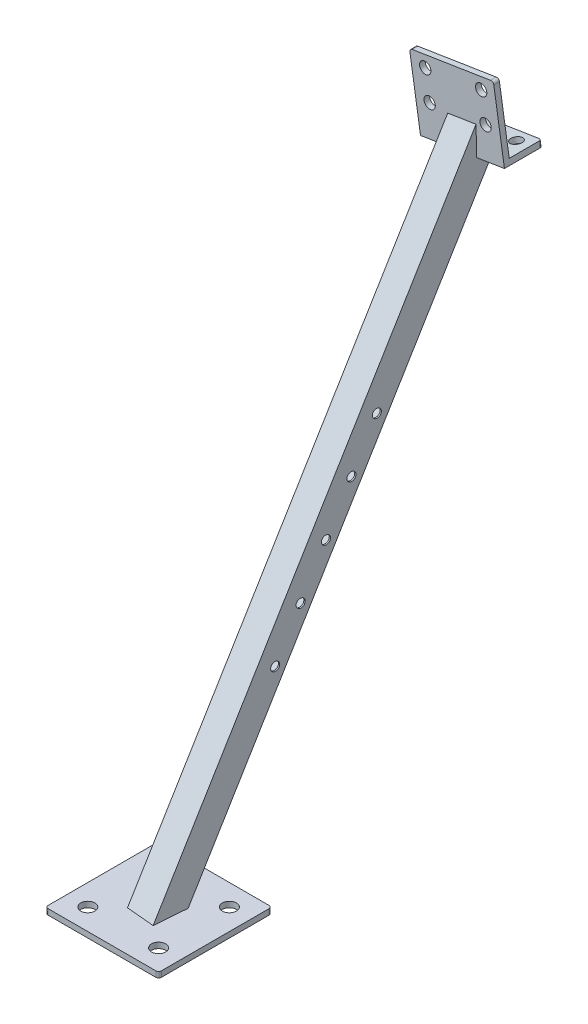
from build123d import *

# Parameters (mm, degrees)
BOSS_EXTRUDE1_DEPTH      = 60
BOSS_EXTRUDE2_DEPTH      = 500
BOSS_EXTRUDE2_DEPTH_BACK = 20
CUT_EXTRUDE1_DEPTH       = 60
BOSS_EXTRUDE3_DEPTH      = 4
SKETCH7_W                = 66.53307322741853
SKETCH7_H                = 100.00000000000006
CUT_EXTRUDE2_DEPTH       = 100
CUT_EXTRUDE3_REACH       = 450.752
SKETCH8_R                = 3.999999996290614
SKETCH8_R_2              = 3.999999996290612
SKETCH8_R_3              = 3.999999996290599
SKETCH8_R_4              = 3.9999999962905974
CUT_EXTRUDE4_REACH       = 450.752
SKETCH9_R                = 4.000000002943936
SKETCH9_R_2              = 4.000000002943917
CUT_EXTRUDE5_REACH       = 492.61
SKETCH10_R               = 5.000000000000006
SKETCH10_R_2             = 5.000000000000005
FILLET1_R                = 2
FILLET2_R                = 2
SKETCH11_RX              = 3.0000000000000298
SKETCH11_RY              = 2.9901642246261853
SKETCH11_RY_2            = 2.990164224626172
SKETCH11_RX_2            = 3.000000000000057
SKETCH11_RX_3            = 3.0000000000000533
SKETCH11_RX_4            = 3.0000000000000058
SKETCH11_RY_3            = 2.9901642246261186
CUT_EXTRUDE6_DEPTH       = 450.440489599581
BODY_MOVE_COPY1_ANGLE    = 9.0000001


with BuildPart() as part:
    # Sketch1 → Boss-Extrude1 (new body)
    with BuildSketch(Plane(origin=(0, 0, 0), x_dir=(0, 0, -1), z_dir=(1, 0, 0))):
        Polygon((0, 0), (0, 50), (4, 50), (4.000000000000005, 4), (27, 4), (27, -2.82e-15), align=None)
    extrude(amount=BOSS_EXTRUDE1_DEPTH)

    # Sketch3 → Boss-Extrude2 (add, two sides: drawn at the far end of the back side and taken through both)
    with BuildSketch(Plane(origin=(0.7341522555726998, 4.014248509947268, -2.3176274578121165), x_dir=(0, -0.5000000000000011, -0.8660254037844382), z_dir=(-0.15643446504023129, -0.8553631939770857, 0.49384417029756994)).offset(-BOSS_EXTRUDE2_DEPTH_BACK)):
        Polygon((-10, 39.63065021785413), (10, 39.63065021785413), (10.000000000000002, 19.630650217854132), (-9.999999999999998, 19.630650217854132), align=None)
        Polygon((-9.000000000000002, 38.63065021785413), (9.000000000000002, 38.63065021785413), (9.000000000000005, 20.630650217854136), (-9, 20.630650217854136), align=None, mode=Mode.SUBTRACT)
    extrude(amount=BOSS_EXTRUDE2_DEPTH + BOSS_EXTRUDE2_DEPTH_BACK)

    # Sketch4 → Cut-Extrude1 (cut)
    with BuildSketch(Plane.ZY):
        Polygon((-4.000000000000005, 3.9999999999999947), (-4.000000000000005, 34.425897354185985), (-31.38403913433122, 4), align=None)
    extrude(amount=-CUT_EXTRUDE1_DEPTH, mode=Mode.SUBTRACT)

    # Sketch6 → Boss-Extrude3 (add)
    with BuildSketch(Plane(origin=(-56.75697758695906, -358.3494490271577, -6.0350178588e-07), x_dir=(0.9876883403131397, -0.15643446682069626, -2.634536772853159e-10), z_dir=(0.15643446682069626, 0.9876883403131398, 1.663381034600109e-09))):
        Polygon((60.60249934727371, -165.5937403388422), (-19.397500652726297, -165.5937403388422), (-19.397500652726286, -245.5937403388422), (60.602499347273714, -245.5937403388422), align=None)
    extrude(amount=BOSS_EXTRUDE3_DEPTH)

    # Sketch7 → Cut-Extrude2 (cut)
    with BuildSketch(Plane(origin=(-56.75697758695889, -358.34944902715785, -6.0350179691e-07), x_dir=(0.9876883403131398, -0.15643446682069573, -2.6345368210226206e-10), z_dir=(-0.15643446682069573, -0.9876883403131398, -1.6633810650131218e-09))):
        with Locations((19.033988730271286, 218.77379525877697)):
            Rectangle(SKETCH7_W, SKETCH7_H)
    extrude(amount=CUT_EXTRUDE2_DEPTH, mode=Mode.SUBTRACT)

    # Sketch8 → Cut-Extrude3 (cut, up to next)
    with BuildSketch(Plane.XY, mode=Mode.PRIVATE) as cut_extrude3_sk1:
        with Locations((10.000000000000002, 21.999999999999982)):
            Circle(SKETCH8_R)
    cut_extrude3_tool1 = extrude(cut_extrude3_sk1.sketch, amount=-CUT_EXTRUDE3_REACH, mode=Mode.PRIVATE) & part.part
    # Sketch8 → Cut-Extrude3 (cut, up to next)
    with BuildSketch(Plane.XY, mode=Mode.PRIVATE) as cut_extrude3_sk2:
        with Locations((50.00000000000001, 21.999999999999975)):
            Circle(SKETCH8_R_2)
    cut_extrude3_tool2 = extrude(cut_extrude3_sk2.sketch, amount=-CUT_EXTRUDE3_REACH, mode=Mode.PRIVATE) & part.part
    # Sketch8 → Cut-Extrude3 (cut, up to next)
    with BuildSketch(Plane.XY, mode=Mode.PRIVATE) as cut_extrude3_sk3:
        with Locations((50.00000000000001, 41.999999999999964)):
            Circle(SKETCH8_R_3)
    cut_extrude3_tool3 = extrude(cut_extrude3_sk3.sketch, amount=-CUT_EXTRUDE3_REACH, mode=Mode.PRIVATE) & part.part
    # Sketch8 → Cut-Extrude3 (cut, up to next)
    with BuildSketch(Plane.XY, mode=Mode.PRIVATE) as cut_extrude3_sk4:
        with Locations((10.000000000000009, 41.99999999999998)):
            Circle(SKETCH8_R_4)
    cut_extrude3_tool4 = extrude(cut_extrude3_sk4.sketch, amount=-CUT_EXTRUDE3_REACH, mode=Mode.PRIVATE) & part.part
    add(cut_extrude3_tool1.solids().sort_by_distance((10, 22, 0))[0], mode=Mode.SUBTRACT)
    add(cut_extrude3_tool2.solids().sort_by_distance((50, 22, 0))[0], mode=Mode.SUBTRACT)
    add(cut_extrude3_tool3.solids().sort_by_distance((50, 42, 0))[0], mode=Mode.SUBTRACT)
    add(cut_extrude3_tool4.solids().sort_by_distance((10, 42, 0))[0], mode=Mode.SUBTRACT)

    # Sketch9 → Cut-Extrude4 (cut, up to next)
    with BuildSketch(Plane.XZ, mode=Mode.PRIVATE) as cut_extrude4_sk1:
        with Locations(Location((50, -18.999999999999968, 0), (0, 0, 270))):
            Circle(SKETCH9_R)
    cut_extrude4_tool1 = extrude(cut_extrude4_sk1.sketch, amount=-CUT_EXTRUDE4_REACH, mode=Mode.PRIVATE) & part.part
    # Sketch9 → Cut-Extrude4 (cut, up to next)
    with BuildSketch(Plane.XZ, mode=Mode.PRIVATE) as cut_extrude4_sk2:
        with Locations(Location((10.000000000000002, -18.999999999999968, 0), (0, 0, 270))):
            Circle(SKETCH9_R_2)
    cut_extrude4_tool2 = extrude(cut_extrude4_sk2.sketch, amount=-CUT_EXTRUDE4_REACH, mode=Mode.PRIVATE) & part.part
    add(cut_extrude4_tool1.solids().sort_by_distance((50, 0, -19))[0], mode=Mode.SUBTRACT)
    add(cut_extrude4_tool2.solids().sort_by_distance((10, 0, -19))[0], mode=Mode.SUBTRACT)

    # Sketch10 → Cut-Extrude5 (cut, up to next)
    with BuildSketch(Plane(origin=(-56.75697758695889, -358.34944902715785, -6.0350179691e-07), x_dir=(0.9876883403131398, -0.15643446682069573, -2.6345368210226206e-10), z_dir=(-0.15643446682069573, -0.9876883403131398, -1.6633810650131218e-09)), mode=Mode.PRIVATE) as cut_extrude5_sk1:
        with Locations((-4.397500652726306, 230.59374033884228)):
            Circle(SKETCH10_R)
    cut_extrude5_tool1 = extrude(cut_extrude5_sk1.sketch, amount=-CUT_EXTRUDE5_REACH, mode=Mode.PRIVATE) & part.part
    # Sketch10 → Cut-Extrude5 (cut, up to next)
    with BuildSketch(Plane(origin=(-56.75697758695889, -358.34944902715785, -6.0350179691e-07), x_dir=(0.9876883403131398, -0.15643446682069573, -2.6345368210226206e-10), z_dir=(-0.15643446682069573, -0.9876883403131398, -1.6633810650131218e-09)), mode=Mode.PRIVATE) as cut_extrude5_sk2:
        with Locations((45.6024993472737, 230.59374033884228)):
            Circle(SKETCH10_R_2)
    cut_extrude5_tool2 = extrude(cut_extrude5_sk2.sketch, amount=-CUT_EXTRUDE5_REACH, mode=Mode.PRIVATE) & part.part
    # Sketch10 → Cut-Extrude5 (cut, up to next)
    with BuildSketch(Plane(origin=(-56.75697758695889, -358.34944902715785, -6.0350179691e-07), x_dir=(0.9876883403131398, -0.15643446682069573, -2.6345368210226206e-10), z_dir=(-0.15643446682069573, -0.9876883403131398, -1.6633810650131218e-09)), mode=Mode.PRIVATE) as cut_extrude5_sk3:
        with Locations((45.60249934727421, 180.59374033884228)):
            Circle(SKETCH10_R_2)
    cut_extrude5_tool3 = extrude(cut_extrude5_sk3.sketch, amount=-CUT_EXTRUDE5_REACH, mode=Mode.PRIVATE) & part.part
    # Sketch10 → Cut-Extrude5 (cut, up to next)
    with BuildSketch(Plane(origin=(-56.75697758695889, -358.34944902715785, -6.0350179691e-07), x_dir=(0.9876883403131398, -0.15643446682069573, -2.6345368210226206e-10), z_dir=(-0.15643446682069573, -0.9876883403131398, -1.6633810650131218e-09)), mode=Mode.PRIVATE) as cut_extrude5_sk4:
        with Locations((-4.397500652725782, 180.59374033884228)):
            Circle(SKETCH10_R)
    cut_extrude5_tool4 = extrude(cut_extrude5_sk4.sketch, amount=-CUT_EXTRUDE5_REACH, mode=Mode.PRIVATE) & part.part
    add(cut_extrude5_tool1.solids().sort_by_distance((-61.100338, -357.661529, 230.59374))[0], mode=Mode.SUBTRACT)
    add(cut_extrude5_tool2.solids().sort_by_distance((-11.715921, -365.483252, 230.59374))[0], mode=Mode.SUBTRACT)
    add(cut_extrude5_tool3.solids().sort_by_distance((-11.715921, -365.483252, 180.59374))[0], mode=Mode.SUBTRACT)
    add(cut_extrude5_tool4.solids().sort_by_distance((-61.100338, -357.661529, 180.59374))[0], mode=Mode.SUBTRACT)

    # Fillet1
    fillet1_edges = [part.edges().sort_by_distance(p)[0] for p in [
        (-75.60279387923194, -353.339634953147, 165.59373974377752),
        (-75.60279387923194, -353.3396350878763, 245.59373974377752),
        (3.412273345819247, -365.8543924335319, 245.59373972270123),
        (3.41227334581924, -365.85439229880274, 165.59373972270123),
    ]]
    fillet(fillet1_edges, radius=FILLET1_R)

    # Fillet2
    fillet2_edges = [part.edges().sort_by_distance(p)[0] for p in [
        (60, 50, -2),
        (0, 50, -2),
        (60, 1.9999999999999987, -27),
        (0, 1.9999999999999987, -27),
    ]]
    fillet(fillet2_edges, radius=FILLET2_R)

    # Sketch11 → Cut-Extrude6 (cut, through all)
    with BuildSketch(Plane(origin=(19.38896433847594, -2.659486302424582, 1.5354551326109596), x_dir=(-0.07749165674017884, 0.010629139135798351, 0.9969363392598818), z_dir=(-0.9876883405951378, 0.13547622075226887, -0.07821723252011582))):
        with Locations(Location((133.97331535443402, -240.08966554254275), (0, 0, -75.12989222147398))):
            Ellipse(SKETCH11_RX, SKETCH11_RY)
        with Locations(Location((116.69258792381987, -209.6617954111425), (0, 0, -75.12989222147398))):
            Ellipse(SKETCH11_RX, SKETCH11_RY_2)
        with Locations(Location((99.41186049320605, -179.23392527974212), (0, 0, -75.12989222147412))):
            Ellipse(SKETCH11_RX_2, SKETCH11_RY_2)
        with Locations(Location((82.13113306259201, -148.8060551483421), (0, 0, -75.12989222147439))):
            Ellipse(SKETCH11_RX_3, SKETCH11_RY_2)
        with Locations(Location((64.85040563197819, -118.37818501694186), (0, 0, -75.12989222147358))):
            Ellipse(SKETCH11_RX_4, SKETCH11_RY_3)
    extrude(amount=-CUT_EXTRUDE6_DEPTH, mode=Mode.SUBTRACT)


with BuildPart() as part_1:
    # Body-Move/Copy1: read off the stored shape, not the designer's step
    # Body-Move/Copy1: moved
    add(part.part.moved(Location((0.6987726, 367.2281966, 0))).rotate(Axis((0, 0, 0), (-1.06e-08, 0, 1.0)), BODY_MOVE_COPY1_ANGLE))


solid = part_1.part
